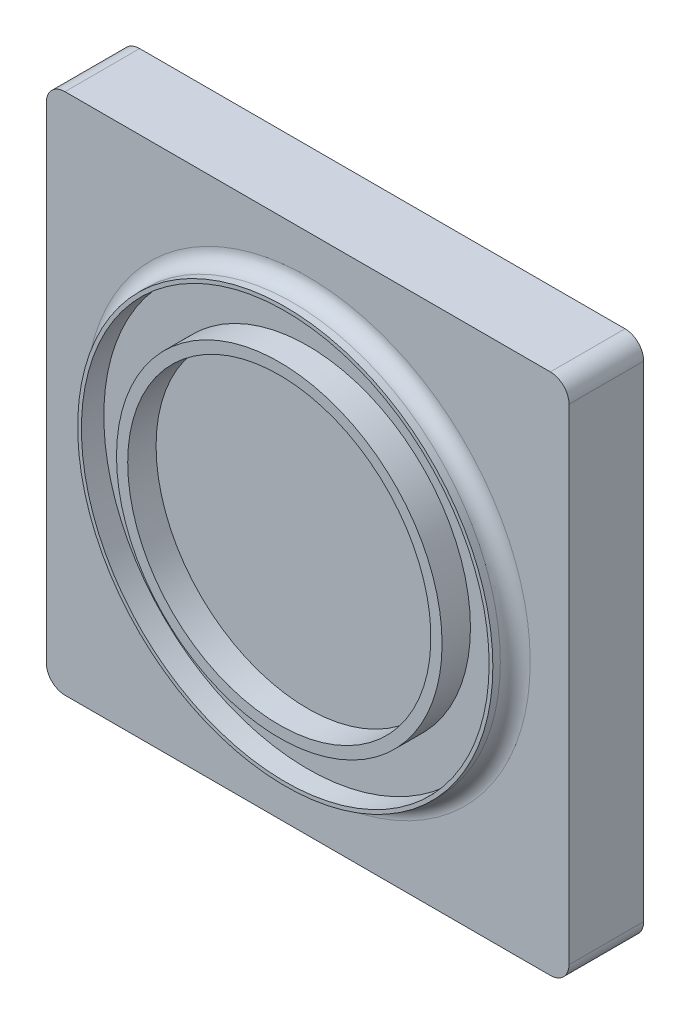
from build123d import *

# Parameters (mm, degrees)
SKETCH1_W           = 70
SKETCH1_H           = 70
BOSS_EXTRUDE1_DEPTH = 10
FILLET1_R           = 2.5
SKETCH5_R           = 27.8
SKETCH5_R_2         = 27.3
BOSS_EXTRUDE5_DEPTH = 3
FILLET2_R           = 2
SKETCH10_R          = 21.8
SKETCH10_R_2        = 20.3
BOSS_EXTRUDE7_DEPTH = 3.8


with BuildPart() as part:
    # Sketch1 → Boss-Extrude1 (new body)
    with BuildSketch(Plane.XY):
        Rectangle(SKETCH1_W, SKETCH1_H)
    extrude(amount=BOSS_EXTRUDE1_DEPTH)

    # Fillet1
    fillet1_edges = [part.edges().sort_by_distance(p)[0] for p in [
        (35, 35, 5),
        (-35, 35, 5),
        (35, -35, 5),
        (-35, -35, 5),
    ]]
    fillet(fillet1_edges, radius=FILLET1_R)

    # Sketch5 → Boss-Extrude5 (add)
    with BuildSketch(Plane.XY.offset(10)):
        Circle(SKETCH5_R)
        Circle(SKETCH5_R_2, mode=Mode.SUBTRACT)
    extrude(amount=BOSS_EXTRUDE5_DEPTH)

    # Fillet2
    fillet2_edges = [part.edges().sort_by_distance(p)[0] for p in [
        (-27.8, 0, 10),
    ]]
    fillet(fillet2_edges, radius=FILLET2_R)

    # Sketch10 → Boss-Extrude7 (add)
    with BuildSketch(Plane.XY.offset(10)):
        Circle(SKETCH10_R)
        Circle(SKETCH10_R_2, mode=Mode.SUBTRACT)
    extrude(amount=BOSS_EXTRUDE7_DEPTH)


solid = part.part
